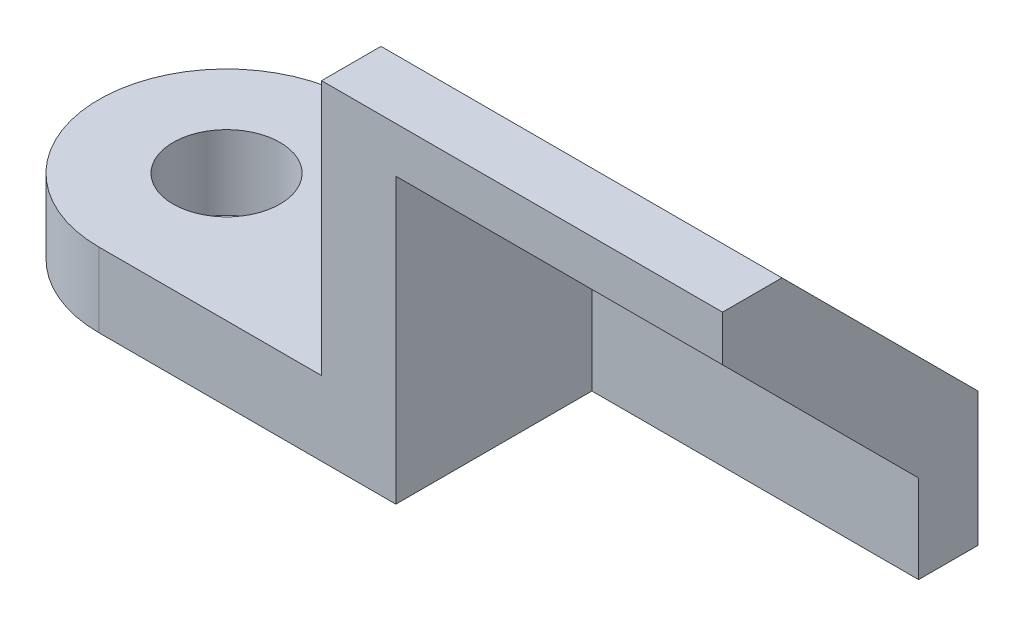
from build123d import *

# Parameters (mm, degrees)
SKETCH1_R           = 2.286
BOSS_EXTRUDE1_DEPTH = 3.175
SKETCH5_W           = 3.175
SKETCH5_H           = 10.922
BOSS_EXTRUDE5_DEPTH = 2.54
BOSS_EXTRUDE6_START = 9.525
BOSS_EXTRUDE6_DEPTH = 3.175
BOSS_EXTRUDE7_DEPTH = 13.97
SKETCH10_R          = 3.1115
CUT_EXTRUDE1_DEPTH  = 3.175
CHAMFER1_SIZE       = 2.54
CHAMFER1_SIZE2      = 3.592102448


# Read off the part's stored shape, not the designer's step: Boss-Extrude6
with BuildPart() as part:
    # Sketch1 → Boss-Extrude1 (new body)
    with BuildSketch(Plane(origin=(0, 0, 0), x_dir=(1, 0, 0), z_dir=(0, 1, 0))):
        with BuildLine():
            Line((0, 5.461), (12.7, 5.461))
            Line((12.7, 5.461), (12.7, -5.461))
            Line((12.7, -5.461), (0, -5.461))
            ThreePointArc((0, -5.461), (-5.461, 0), (0, 5.461))
        make_face()
        with Locations(Location((0, 0, 0), (0, 0, 270))):
            Circle(SKETCH1_R, mode=Mode.SUBTRACT)
    extrude(amount=BOSS_EXTRUDE1_DEPTH)

    # Sketch5 → Boss-Extrude5 (add)
    with BuildSketch(Plane(origin=(0, 3.175, 0), x_dir=(1, 0, 0), z_dir=(0, 1, 0))):
        with Locations((11.1125, 0)):
            Rectangle(SKETCH5_W, SKETCH5_H)
    extrude(amount=BOSS_EXTRUDE5_DEPTH)

    # Boss-Extrude6 outline → Boss-Extrude6 (add)
    with BuildSketch(Plane.YZ.offset(BOSS_EXTRUDE6_START)):
        Polygon((16.637, 5.461), (5.715, 5.461), (5.715, -5.461), align=None)
    extrude(amount=BOSS_EXTRUDE6_DEPTH)

    # Sketch9 → Boss-Extrude7 (add)
    with BuildSketch(Plane(origin=(12.7, 0, 0), x_dir=(0, 0, -1), z_dir=(1, 0, 0))):
        Polygon((-5.461, 16.637), (-5.461, 12.146871939), (2.921, 3.764871939), (2.921, 0), (5.461, 0), (5.461, 1.224871939), (5.461, 5.715), align=None)
    extrude(amount=BOSS_EXTRUDE7_DEPTH)

    # Sketch10 → Cut-Extrude1 (cut)
    with BuildSketch(Plane(origin=(0, 5.588, -5.588), x_dir=(1, 0, 0), z_dir=(0, 0.7071067811865465, -0.7071067811865487))):
        with Locations(Location((20.32, -6.529605122, 0), (0, 0, 270))):
            Circle(SKETCH10_R)
    extrude(amount=-CUT_EXTRUDE1_DEPTH, mode=Mode.SUBTRACT)

    # Chamfer1
    chamfer1_edges = [part.edges().sort_by_distance(p)[0] for p in [
        (18.0975, 16.637, 5.461),
    ]]
    chamfer1_side = [part.faces().sort_by_distance(p)[0] for p in [
        (12.385662813, 6.07343597, 5.461),
    ]]
    chamfer(chamfer1_edges, length=CHAMFER1_SIZE, length2=CHAMFER1_SIZE2, reference=chamfer1_side[0])


solid = part.part
